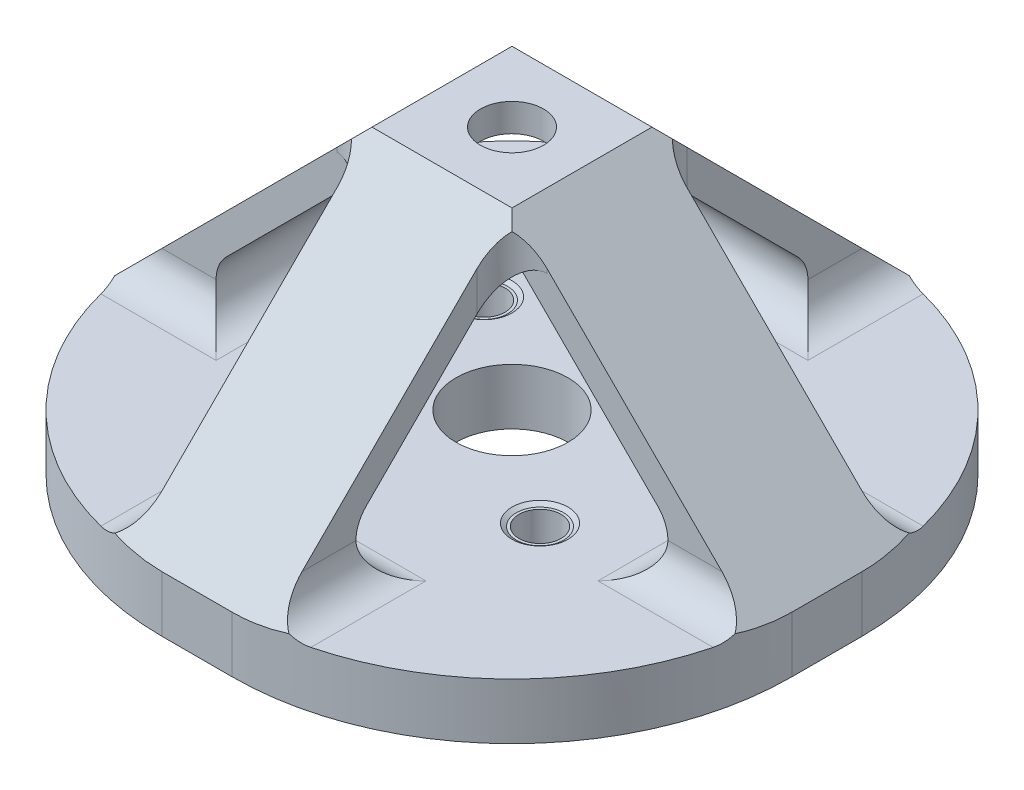
from build123d import *
from OCP.BRepFilletAPI import BRepFilletAPI_MakeChamfer

# Parameters (mm, degrees)
SKETCH1_W           = 45
SKETCH1_H           = 45
BOSS_EXTRUDE1_DEPTH = 4
SKETCH2_R           = 1.5
CUT_EXTRUDE1_DEPTH  = 4
SKETCH3_R           = 2
CUT_EXTRUDE2_DEPTH  = 0.2
CHAMFER1_SIZE       = 0.2
CHAMFER1_SIZE_2     = 0.307972993
BOSS_EXTRUDE2_DEPTH = 5
BOSS_EXTRUDE3_DEPTH = 5
SKETCH7_R           = 2.25
CUT_EXTRUDE3_DEPTH  = 32
SKETCH8_R           = 4
CUT_EXTRUDE4_DEPTH  = 10
FILLET1_R           = 2.5
FILLET2_R           = 20


# Some blends are built 0.0001 mm under size
with BuildPart() as part:
    # Sketch1 → Boss-Extrude1 (new body)
    with BuildSketch(Plane(origin=(0, 0, 0), x_dir=(1, 0, 0), z_dir=(0, 1, 0))):
        Rectangle(SKETCH1_W, SKETCH1_H)
    extrude(amount=BOSS_EXTRUDE1_DEPTH)

    # Sketch2 → Cut-Extrude1 (cut)
    with BuildSketch(Plane(origin=(0, 4, 0), x_dir=(1, 0, 0), z_dir=(0, 1, 0))):
        with Locations(Location((-8, 6, 0), (0, 0, 270))):
            Circle(SKETCH2_R)
        with Locations(Location((8, 6, 0), (0, 0, 270))):
            Circle(SKETCH2_R)
        with Locations(Location((8, -6, 0), (0, 0, 270))):
            Circle(SKETCH2_R)
        with Locations(Location((-8, -6, 0), (0, 0, 270))):
            Circle(SKETCH2_R)
    extrude(amount=-CUT_EXTRUDE1_DEPTH, mode=Mode.SUBTRACT)

    # Sketch3 → Cut-Extrude2 (cut)
    with BuildSketch(Plane(origin=(0, 4, 0), x_dir=(1, 0, 0), z_dir=(0, 1, 0))):
        with Locations(Location((-8, 6, 0), (0, 0, 270))):
            Circle(SKETCH3_R)
        with Locations(Location((8, 6, 0), (0, 0, 270))):
            Circle(SKETCH3_R)
        with Locations(Location((8, -6, 0), (0, 0, 270))):
            Circle(SKETCH3_R)
        with Locations(Location((-8, -6, 0), (0, 0, 270))):
            Circle(SKETCH3_R)
    extrude(amount=-CUT_EXTRUDE2_DEPTH, mode=Mode.SUBTRACT)

    # Chamfer1
    chamfer1_edges_1 = [part.edges().sort_by_distance(p)[0] for p in [
        (-8, 3.8, 4),
    ]]
    chamfer1_side_1 = [part.faces().sort_by_distance(p)[0] for p in [
        (-8, 3.804, 4),
    ]]
    chamfer1_edges_2 = [part.edges().sort_by_distance(p)[0] for p in [
        (8, 3.8, 4),
    ]]
    chamfer1_side_2 = [part.faces().sort_by_distance(p)[0] for p in [
        (8, 3.804, 4),
    ]]
    chamfer1_edges_3 = [part.edges().sort_by_distance(p)[0] for p in [
        (8, 3.8, -8),
    ]]
    chamfer1_side_3 = [part.faces().sort_by_distance(p)[0] for p in [
        (8, 3.804, -8),
    ]]
    chamfer1_edges_4 = [part.edges().sort_by_distance(p)[0] for p in [
        (-8, 3.8, -8),
    ]]
    chamfer1_side_4 = [part.faces().sort_by_distance(p)[0] for p in [
        (-8, 3.804, -8),
    ]]
    chamfer1 = BRepFilletAPI_MakeChamfer(part.part.solid().wrapped)
    for e in chamfer1_edges_1:
        chamfer1.Add(CHAMFER1_SIZE - 0.0001, CHAMFER1_SIZE_2 - 0.0001, e.wrapped, chamfer1_side_1[0].wrapped)
    for e in chamfer1_edges_2:
        chamfer1.Add(CHAMFER1_SIZE - 0.0001, CHAMFER1_SIZE_2 - 0.0001, e.wrapped, chamfer1_side_2[0].wrapped)
    for e in chamfer1_edges_3:
        chamfer1.Add(CHAMFER1_SIZE - 0.0001, CHAMFER1_SIZE_2 - 0.0001, e.wrapped, chamfer1_side_3[0].wrapped)
    for e in chamfer1_edges_4:
        chamfer1.Add(CHAMFER1_SIZE - 0.0001, CHAMFER1_SIZE_2 - 0.0001, e.wrapped, chamfer1_side_4[0].wrapped)
    add(Compound.cast(chamfer1.Shape()), mode=Mode.REPLACE)  # a hair under: the kernel refuses the full size

    # Sketch5 → Boss-Extrude2 (add, symmetric)
    with BuildSketch(Plane.XY):
        Polygon((-5, 21.5), (-22.5, 4), (-21.085786438, 2.585786438), (-4.171572875, 19.5), (4.171572875, 19.5), (21.085786438, 2.585786438), (22.5, 4), (5, 21.5), align=None)
    extrude(amount=BOSS_EXTRUDE2_DEPTH, both=True)

    # Sketch6 → Boss-Extrude3 (add, symmetric)
    with BuildSketch(Plane(origin=(0, 0, 0), x_dir=(0, 0, -1), z_dir=(1, 0, 0))):
        Polygon((-5, 21.5), (-22.5, 4), (-21.084645553, 2.586928244), (-4.198851287, 19.5), (-2.202076898, 21.5), align=None)
        Polygon((22.5, 4), (5, 21.5), (2.171572875, 21.5), (4.171572875, 19.5), (21.085786438, 2.585786438), align=None)
    extrude(amount=BOSS_EXTRUDE3_DEPTH, both=True)

    # Sketch7 → Cut-Extrude3 (cut)
    with BuildSketch(Plane(origin=(0, 21.5, 0), x_dir=(1, 0, 0), z_dir=(0, 1, 0))):
        with Locations(Location((0, 0, 0), (0, 0, 270))):
            Circle(SKETCH7_R)
    extrude(amount=-CUT_EXTRUDE3_DEPTH, mode=Mode.SUBTRACT)

    # Sketch8 → Cut-Extrude4 (cut)
    with BuildSketch(Plane.XZ):
        with Locations(Location((0, 0, 0), (0, 0, 270))):
            Circle(SKETCH8_R)
    extrude(amount=-CUT_EXTRUDE4_DEPTH, mode=Mode.SUBTRACT)

    # Fillet1
    # the kernel refuses this fillet: 2.5 mm, written as the material it adds along each edge
    with BuildSketch(Plane(origin=(-5, 12.447557103, 5), x_dir=(0, 0, 1), z_dir=(0, 1, 0))) as fillet1_piece_1_section:
        with BuildLine():
            CenterArc((FILLET1_R, -FILLET1_R), FILLET1_R, 90, 90)
            Line((0, -FILLET1_R), (0, 0))
            Line((0, 0), (FILLET1_R, 0))
        make_face()
    fillet1_piece_1 = extrude(amount=15.302442897, mode=Mode.PRIVATE)
    fillet1_piece_1 = split(fillet1_piece_1, bisect_by=Plane(origin=(-5, 15.567513023, 8.124995929), z_dir=(0, 0.7065358781304153, 0.707677223679329)), keep=Keep.TOP, mode=Mode.PRIVATE)
    fillet1_piece_1 = split(fillet1_piece_1, bisect_by=Plane(origin=(-5, 16.973778552, 9.526221448), z_dir=(0, -0.7071067811865495, -0.7071067811865457)), keep=Keep.TOP, mode=Mode.PRIVATE)
    fillet1_piece_1 = split(fillet1_piece_1, bisect_by=Plane(origin=(-9.526221448, 16.973778552, 5), z_dir=(0.7071067811865489, -0.7071067811865462, 0)), keep=Keep.TOP, mode=Mode.PRIVATE)
    add(fillet1_piece_1)
    with BuildSketch(Plane(origin=(5, 12.447557103, 5), x_dir=(1, 0, 0), z_dir=(0, 1, 0))) as fillet1_piece_2_section:
        with BuildLine():
            CenterArc((FILLET1_R, -FILLET1_R), FILLET1_R, 90, 90)
            Line((0, -FILLET1_R), (0, 0))
            Line((0, 0), (FILLET1_R, 0))
        make_face()
    fillet1_piece_2 = extrude(amount=15.302442897, mode=Mode.PRIVATE)
    fillet1_piece_2 = split(fillet1_piece_2, bisect_by=Plane(origin=(5, 15.567513023, 8.124995929), z_dir=(0, 0.7065358781304153, 0.707677223679329)), keep=Keep.TOP, mode=Mode.PRIVATE)
    fillet1_piece_2 = split(fillet1_piece_2, bisect_by=Plane(origin=(9.526221448, 16.973778552, 5), z_dir=(-0.7071067811865437, -0.7071067811865513, 0)), keep=Keep.TOP, mode=Mode.PRIVATE)
    fillet1_piece_2 = split(fillet1_piece_2, bisect_by=Plane(origin=(5, 16.973778552, 9.526221448), z_dir=(0, -0.7071067811865495, -0.7071067811865457)), keep=Keep.TOP, mode=Mode.PRIVATE)
    add(fillet1_piece_2)
    with BuildSketch(Plane(origin=(4.171572875, 19.5, -6.76040764), x_dir=(0.7071067811865543, -0.7071067811865406, 0), z_dir=(0, 0, 1))) as fillet1_piece_3:
        with BuildLine():
            CenterArc((FILLET1_R * 0.414213562373, -FILLET1_R), FILLET1_R, 90, 45)
            Line((-FILLET1_R * 0.292893218813, -FILLET1_R * 0.292893218813), (0, 0))
            Line((0, 0), (FILLET1_R * 0.414213562373, 0))
        make_face()
    extrude(amount=13.548093692)
    with BuildSketch(Plane(origin=(-4.171572875, 19.5, -6.76040764), x_dir=(-0.7071067811865471, -0.707106781186548, 0), z_dir=(0, 0, 1))) as fillet1_piece_4:
        with BuildLine():
            CenterArc((FILLET1_R * 0.414213562373, FILLET1_R), FILLET1_R, 225, 45)
            Line((-FILLET1_R * 0.292893218813, FILLET1_R * 0.292893218813), (0, 0))
            Line((0, 0), (FILLET1_R * 0.414213562373, 0))
        make_face()
    extrude(amount=13.548093692)
    with BuildSketch(Plane(origin=(-5, 4, 19.673852806), x_dir=(0, 0, -1), z_dir=(1, 0, 0))) as fillet1_piece_5:
        with BuildLine():
            CenterArc((FILLET1_R * 2.41146079177, FILLET1_R), FILLET1_R, 135.046240746, 134.953759254)
            Line((FILLET1_R * 1.70378356809, FILLET1_R * 1.70653587813), (0, 0))
            Line((0, 0), (FILLET1_R * 2.41146079177, 0))
        make_face()
    extrude(amount=10)
    with BuildSketch(Plane(origin=(-5, 4, 13.423852806), x_dir=(-1, 0, 0), z_dir=(0, 0, 1))) as fillet1_piece_6_section:
        with BuildLine():
            CenterArc((FILLET1_R, -FILLET1_R), FILLET1_R, 90, 90)
            Line((0, -FILLET1_R), (0, 0))
            Line((0, 0), (FILLET1_R, 0))
        make_face()
    fillet1_piece_6 = extrude(amount=15.326147194, mode=Mode.PRIVATE)
    fillet1_piece_6 = split(fillet1_piece_6, bisect_by=Plane(origin=(-5, 7.124995929, 16.553896887), z_dir=(0, 0.7065358781304153, 0.707677223679329)), keep=Keep.TOP, mode=Mode.PRIVATE)
    fillet1_piece_6 = split(fillet1_piece_6, bisect_by=Plane(origin=(-5, 8.538073597, 17.961926403), z_dir=(0, -0.7071067811865495, -0.7071067811865457)), keep=Keep.TOP, mode=Mode.PRIVATE)
    add(fillet1_piece_6)
    with BuildSketch(Plane(origin=(-6.76336289, 19.5, 4.198851287), x_dir=(0, -0.7076772236793294, 0.706535878130415), z_dir=(1, 0, 0))) as fillet1_piece_7:
        with BuildLine():
            CenterArc((FILLET1_R * 0.414686402289, FILLET1_R), FILLET1_R, 224.953759254, 45.046240746)
            Line((-FILLET1_R * 0.29299082139, FILLET1_R * 0.29346412187), (0, 0))
            Line((0, 0), (FILLET1_R * 0.414686402289, 0))
        make_face()
    extrude(amount=13.526725779)
    with BuildSketch(Plane(origin=(5, 4, 13.423852806), x_dir=(1, 0, 0), z_dir=(0, 0, 1))) as fillet1_piece_8_section:
        with BuildLine():
            CenterArc((FILLET1_R, FILLET1_R), FILLET1_R, 180, 90)
            Line((0, FILLET1_R), (0, 0))
            Line((0, 0), (FILLET1_R, 0))
        make_face()
    fillet1_piece_8 = extrude(amount=15.326147194, mode=Mode.PRIVATE)
    fillet1_piece_8 = split(fillet1_piece_8, bisect_by=Plane(origin=(5, 7.124995929, 16.553896887), z_dir=(0, 0.7065358781304153, 0.707677223679329)), keep=Keep.TOP, mode=Mode.PRIVATE)
    fillet1_piece_8 = split(fillet1_piece_8, bisect_by=Plane(origin=(5, 8.538073597, 17.961926403), z_dir=(0, -0.7071067811865495, -0.7071067811865457)), keep=Keep.TOP, mode=Mode.PRIVATE)
    add(fillet1_piece_8)
    with BuildSketch(Plane(origin=(-5, 12.421572875, -5), x_dir=(0, 0, -1), z_dir=(0, 1, 0))) as fillet1_piece_9_section:
        with BuildLine():
            CenterArc((FILLET1_R, FILLET1_R), FILLET1_R, 180, 90)
            Line((0, FILLET1_R), (0, 0))
            Line((0, 0), (FILLET1_R, 0))
        make_face()
    fillet1_piece_9 = extrude(amount=15.328427125, mode=Mode.PRIVATE)
    fillet1_piece_9 = split(fillet1_piece_9, bisect_by=Plane(origin=(-8.125, 15.546572875, -5), z_dir=(-0.7071067811865477, 0.7071067811865475, 0)), keep=Keep.TOP, mode=Mode.PRIVATE)
    fillet1_piece_9 = split(fillet1_piece_9, bisect_by=Plane(origin=(-5, 16.960786438, -9.539213562), z_dir=(0, -0.7071067811865464, 0.7071067811865488)), keep=Keep.TOP, mode=Mode.PRIVATE)
    fillet1_piece_9 = split(fillet1_piece_9, bisect_by=Plane(origin=(-9.539213562, 16.960786438, -5), z_dir=(0.7071067811865489, -0.7071067811865462, 0)), keep=Keep.TOP, mode=Mode.PRIVATE)
    add(fillet1_piece_9)
    with BuildSketch(Plane(origin=(-5, 12.421572875, -5), x_dir=(0, 0, -1), z_dir=(0, 1, 0))) as fillet1_piece_10_section:
        with BuildLine():
            CenterArc((FILLET1_R, FILLET1_R), FILLET1_R, 180, 90)
            Line((0, FILLET1_R), (0, 0))
            Line((0, 0), (FILLET1_R, 0))
        make_face()
    fillet1_piece_10 = extrude(amount=15.328427125, mode=Mode.PRIVATE)
    fillet1_piece_10 = split(fillet1_piece_10, bisect_by=Plane(origin=(-5, 15.546572875, -8.125), z_dir=(0, 0.7071067811865475, -0.7071067811865476)), keep=Keep.TOP, mode=Mode.PRIVATE)
    fillet1_piece_10 = split(fillet1_piece_10, bisect_by=Plane(origin=(-5, 16.960786438, -9.539213562), z_dir=(0, -0.7071067811865464, 0.7071067811865488)), keep=Keep.TOP, mode=Mode.PRIVATE)
    fillet1_piece_10 = split(fillet1_piece_10, bisect_by=Plane(origin=(-9.539213562, 16.960786438, -5), z_dir=(0.7071067811865489, -0.7071067811865462, 0)), keep=Keep.TOP, mode=Mode.PRIVATE)
    add(fillet1_piece_10)
    with BuildSketch(Plane(origin=(5, 12.421572875, -5), x_dir=(1, 0, 0), z_dir=(0, 1, 0))) as fillet1_piece_11_section:
        with BuildLine():
            CenterArc((FILLET1_R, FILLET1_R), FILLET1_R, 180, 90)
            Line((0, FILLET1_R), (0, 0))
            Line((0, 0), (FILLET1_R, 0))
        make_face()
    fillet1_piece_11 = extrude(amount=15.328427125, mode=Mode.PRIVATE)
    fillet1_piece_11 = split(fillet1_piece_11, bisect_by=Plane(origin=(5, 15.546572875, -8.125), z_dir=(0, 0.7071067811865475, -0.7071067811865476)), keep=Keep.TOP, mode=Mode.PRIVATE)
    fillet1_piece_11 = split(fillet1_piece_11, bisect_by=Plane(origin=(9.539213562, 16.960786438, -5), z_dir=(-0.7071067811865437, -0.7071067811865513, 0)), keep=Keep.TOP, mode=Mode.PRIVATE)
    fillet1_piece_11 = split(fillet1_piece_11, bisect_by=Plane(origin=(5, 16.960786438, -9.539213562), z_dir=(0, -0.7071067811865464, 0.7071067811865488)), keep=Keep.TOP, mode=Mode.PRIVATE)
    add(fillet1_piece_11)
    with BuildSketch(Plane(origin=(5, 12.421572875, -5), x_dir=(1, 0, 0), z_dir=(0, 1, 0))) as fillet1_piece_12_section:
        with BuildLine():
            CenterArc((FILLET1_R, FILLET1_R), FILLET1_R, 180, 90)
            Line((0, FILLET1_R), (0, 0))
            Line((0, 0), (FILLET1_R, 0))
        make_face()
    fillet1_piece_12 = extrude(amount=15.328427125, mode=Mode.PRIVATE)
    fillet1_piece_12 = split(fillet1_piece_12, bisect_by=Plane(origin=(8.125, 15.546572875, -5), z_dir=(0.7071067811865437, 0.7071067811865513, 0)), keep=Keep.TOP, mode=Mode.PRIVATE)
    fillet1_piece_12 = split(fillet1_piece_12, bisect_by=Plane(origin=(9.539213562, 16.960786438, -5), z_dir=(-0.7071067811865437, -0.7071067811865513, 0)), keep=Keep.TOP, mode=Mode.PRIVATE)
    fillet1_piece_12 = split(fillet1_piece_12, bisect_by=Plane(origin=(5, 16.960786438, -9.539213562), z_dir=(0, -0.7071067811865464, 0.7071067811865488)), keep=Keep.TOP, mode=Mode.PRIVATE)
    add(fillet1_piece_12)
    with BuildSketch(Plane(origin=(6.76040764, 19.5, -4.171572875), x_dir=(0, -0.7071067811865476, -0.7071067811865476), z_dir=(-1, 0, 0))) as fillet1_piece_13:
        with BuildLine():
            CenterArc((FILLET1_R * 0.414213562373, FILLET1_R), FILLET1_R, 225, 45)
            Line((-FILLET1_R * 0.292893218813, FILLET1_R * 0.292893218813), (0, 0))
            Line((0, 0), (FILLET1_R * 0.414213562373, 0))
        make_face()
    extrude(amount=13.52081528)
    with BuildSketch(Plane(origin=(5, 4, -19.671572875), x_dir=(0, 0, 1), z_dir=(-1, 0, 0)), Plane(origin=(19.671572875, 4, 5), x_dir=(-1, 0, 0), z_dir=(0, 0, -1)), Plane(origin=(-19.671572875, 4, -5), x_dir=(1, 0, 0), z_dir=(0, 0, 1))) as fillet1_piece_14:
        with BuildLine():
            CenterArc((FILLET1_R * 2.41421356237, FILLET1_R), FILLET1_R, 135, 135)
            Line((FILLET1_R * 1.70710678119, FILLET1_R * 1.70710678119), (0, 0))
            Line((0, 0), (FILLET1_R * 2.41421356237, 0))
        make_face()
    extrude(amount=10)
    with BuildSketch(Plane(origin=(5, 4, -28.75), x_dir=(1, 0, 0), z_dir=(0, 0, 1))) as fillet1_piece_15_section:
        with BuildLine():
            CenterArc((FILLET1_R, FILLET1_R), FILLET1_R, 180, 90)
            Line((0, FILLET1_R), (0, 0))
            Line((0, 0), (FILLET1_R, 0))
        make_face()
    fillet1_piece_15 = extrude(amount=15.328427125, mode=Mode.PRIVATE)
    fillet1_piece_15 = split(fillet1_piece_15, bisect_by=Plane(origin=(5, -0.539213562, -24.210786438), z_dir=(0, 0.7071067811865475, -0.7071067811865476)), keep=Keep.TOP, mode=Mode.PRIVATE)
    fillet1_piece_15 = split(fillet1_piece_15, bisect_by=Plane(origin=(5, 0.875, -25.625), z_dir=(0, -0.7071067811865464, 0.7071067811865488)), keep=Keep.TOP, mode=Mode.PRIVATE)
    add(fillet1_piece_15)
    with BuildSketch(Plane(origin=(-5, 4, -28.75), x_dir=(-1, 0, 0), z_dir=(0, 0, 1))) as fillet1_piece_16_section:
        with BuildLine():
            CenterArc((FILLET1_R, -FILLET1_R), FILLET1_R, 90, 90)
            Line((0, -FILLET1_R), (0, 0))
            Line((0, 0), (FILLET1_R, 0))
        make_face()
    fillet1_piece_16 = extrude(amount=15.328427125, mode=Mode.PRIVATE)
    fillet1_piece_16 = split(fillet1_piece_16, bisect_by=Plane(origin=(-5, -0.539213562, -24.210786438), z_dir=(0, 0.7071067811865475, -0.7071067811865476)), keep=Keep.TOP, mode=Mode.PRIVATE)
    fillet1_piece_16 = split(fillet1_piece_16, bisect_by=Plane(origin=(-5, 0.875, -25.625), z_dir=(0, -0.7071067811865464, 0.7071067811865488)), keep=Keep.TOP, mode=Mode.PRIVATE)
    add(fillet1_piece_16)
    with BuildSketch(Plane(origin=(28.75, 4, -5), x_dir=(0, 0, -1), z_dir=(-1, 0, 0))) as fillet1_piece_17_section:
        with BuildLine():
            CenterArc((FILLET1_R, -FILLET1_R), FILLET1_R, 90, 90)
            Line((0, -FILLET1_R), (0, 0))
            Line((0, 0), (FILLET1_R, 0))
        make_face()
    fillet1_piece_17 = extrude(amount=15.328427125, mode=Mode.PRIVATE)
    fillet1_piece_17 = split(fillet1_piece_17, bisect_by=Plane(origin=(24.210786438, -0.539213562, -5), z_dir=(0.7071067811865437, 0.7071067811865513, 0)), keep=Keep.TOP, mode=Mode.PRIVATE)
    fillet1_piece_17 = split(fillet1_piece_17, bisect_by=Plane(origin=(25.625, 0.875, -5), z_dir=(-0.7071067811865437, -0.7071067811865513, 0)), keep=Keep.TOP, mode=Mode.PRIVATE)
    add(fillet1_piece_17)
    with BuildSketch(Plane(origin=(28.75, 4, 5), x_dir=(0, 0, 1), z_dir=(-1, 0, 0))) as fillet1_piece_18_section:
        with BuildLine():
            CenterArc((FILLET1_R, FILLET1_R), FILLET1_R, 180, 90)
            Line((0, FILLET1_R), (0, 0))
            Line((0, 0), (FILLET1_R, 0))
        make_face()
    fillet1_piece_18 = extrude(amount=15.328427125, mode=Mode.PRIVATE)
    fillet1_piece_18 = split(fillet1_piece_18, bisect_by=Plane(origin=(24.210786438, -0.539213562, 5), z_dir=(0.7071067811865437, 0.7071067811865513, 0)), keep=Keep.TOP, mode=Mode.PRIVATE)
    fillet1_piece_18 = split(fillet1_piece_18, bisect_by=Plane(origin=(25.625, 0.875, 5), z_dir=(-0.7071067811865437, -0.7071067811865513, 0)), keep=Keep.TOP, mode=Mode.PRIVATE)
    add(fillet1_piece_18)
    with BuildSketch(Plane(origin=(-13.421572875, 4, -5), x_dir=(0, 0, -1), z_dir=(-1, 0, 0))) as fillet1_piece_19_section:
        with BuildLine():
            CenterArc((FILLET1_R, -FILLET1_R), FILLET1_R, 90, 90)
            Line((0, -FILLET1_R), (0, 0))
            Line((0, 0), (FILLET1_R, 0))
        make_face()
    fillet1_piece_19 = extrude(amount=15.328427125, mode=Mode.PRIVATE)
    fillet1_piece_19 = split(fillet1_piece_19, bisect_by=Plane(origin=(-16.546572875, 7.125, -5), z_dir=(-0.7071067811865477, 0.7071067811865475, 0)), keep=Keep.TOP, mode=Mode.PRIVATE)
    fillet1_piece_19 = split(fillet1_piece_19, bisect_by=Plane(origin=(-17.960786438, 8.539213562, -5), z_dir=(0.7071067811865489, -0.7071067811865462, 0)), keep=Keep.TOP, mode=Mode.PRIVATE)
    add(fillet1_piece_19)
    with BuildSketch(Plane(origin=(-13.421572875, 4, 5), x_dir=(0, 0, 1), z_dir=(-1, 0, 0))) as fillet1_piece_20_section:
        with BuildLine():
            CenterArc((FILLET1_R, FILLET1_R), FILLET1_R, 180, 90)
            Line((0, FILLET1_R), (0, 0))
            Line((0, 0), (FILLET1_R, 0))
        make_face()
    fillet1_piece_20 = extrude(amount=15.328427125, mode=Mode.PRIVATE)
    fillet1_piece_20 = split(fillet1_piece_20, bisect_by=Plane(origin=(-16.546572875, 7.125, 5), z_dir=(-0.7071067811865477, 0.7071067811865475, 0)), keep=Keep.TOP, mode=Mode.PRIVATE)
    fillet1_piece_20 = split(fillet1_piece_20, bisect_by=Plane(origin=(-17.960786438, 8.539213562, 5), z_dir=(0.7071067811865489, -0.7071067811865462, 0)), keep=Keep.TOP, mode=Mode.PRIVATE)
    add(fillet1_piece_20)
    with BuildSketch(Plane(origin=(-20.071629949, 4, 19.673852806), x_dir=(0, 0, -1), z_dir=(1, 0, 0))) as fillet1_piece_21a_section:
        with BuildLine():
            CenterArc((FILLET1_R * 2.41146079177, FILLET1_R), FILLET1_R, 135.046240746, 134.953759254)
            Line((FILLET1_R * 1.70378356809, FILLET1_R * 1.70653587813), (0, 0))
            Line((0, 0), (FILLET1_R * 2.41146079177, 0))
        make_face()
    fillet1_piece_21a = extrude(amount=25.071629949, mode=Mode.PRIVATE)
    fillet1_piece_21a = split(fillet1_piece_21a, bisect_by=Plane(origin=(-5, 4, 19.673852806), z_dir=(-1, 0, 0)), keep=Keep.TOP, mode=Mode.PRIVATE)
    with BuildSketch(Plane(origin=(-5, 4, 13.423852806), x_dir=(-1, 0, 0), z_dir=(0, 0, 1))) as fillet1_piece_21b_section:
        with BuildLine():
            CenterArc((FILLET1_R, -FILLET1_R), FILLET1_R, 90, 90)
            Line((0, -FILLET1_R), (0, 0))
            Line((0, 0), (FILLET1_R, 0))
        make_face()
    fillet1_piece_21b = extrude(amount=9.076147194, mode=Mode.PRIVATE)
    fillet1_piece_21b = split(fillet1_piece_21b, bisect_by=Plane(origin=(-5, 7.124995929, 16.553896887), z_dir=(0, -0.7065358781304153, -0.707677223679329)), keep=Keep.TOP, mode=Mode.PRIVATE)
    fillet1_piece_21 = fillet1_piece_21a & fillet1_piece_21b
    add(fillet1_piece_21)
    with BuildSketch(Plane(origin=(5, 4, 13.423852806), x_dir=(1, 0, 0), z_dir=(0, 0, 1))) as fillet1_piece_22a_section:
        with BuildLine():
            CenterArc((FILLET1_R, FILLET1_R), FILLET1_R, 180, 90)
            Line((0, FILLET1_R), (0, 0))
            Line((0, 0), (FILLET1_R, 0))
        make_face()
    fillet1_piece_22a = extrude(amount=9.076147194, mode=Mode.PRIVATE)
    fillet1_piece_22a = split(fillet1_piece_22a, bisect_by=Plane(origin=(5, 7.124995929, 16.553896887), z_dir=(0, -0.7065358781304153, -0.707677223679329)), keep=Keep.TOP, mode=Mode.PRIVATE)
    with BuildSketch(Plane(origin=(-5, 4, 19.673852806), x_dir=(0, 0, -1), z_dir=(1, 0, 0))) as fillet1_piece_22b_section:
        with BuildLine():
            CenterArc((FILLET1_R * 2.41146079177, FILLET1_R), FILLET1_R, 135.046240746, 134.953759254)
            Line((FILLET1_R * 1.70378356809, FILLET1_R * 1.70653587813), (0, 0))
            Line((0, 0), (FILLET1_R * 2.41146079177, 0))
        make_face()
    fillet1_piece_22b = extrude(amount=25.071629949, mode=Mode.PRIVATE)
    fillet1_piece_22b = split(fillet1_piece_22b, bisect_by=Plane(origin=(5, 4, 19.673852806), z_dir=(1, 0, 0)), keep=Keep.TOP, mode=Mode.PRIVATE)
    fillet1_piece_22 = fillet1_piece_22a & fillet1_piece_22b
    add(fillet1_piece_22)
    with BuildSketch(Plane(origin=(5, 4, -22.5), x_dir=(1, 0, 0), z_dir=(0, 0, 1))) as fillet1_piece_23a_section:
        with BuildLine():
            CenterArc((FILLET1_R, FILLET1_R), FILLET1_R, 180, 90)
            Line((0, FILLET1_R), (0, 0))
            Line((0, 0), (FILLET1_R, 0))
        make_face()
    fillet1_piece_23a = extrude(amount=9.078427125, mode=Mode.PRIVATE)
    fillet1_piece_23a = split(fillet1_piece_23a, bisect_by=Plane(origin=(5, 2.585786438, -21.085786438), z_dir=(0, -0.7071067811865475, 0.7071067811865476)), keep=Keep.TOP, mode=Mode.PRIVATE)
    with BuildSketch(Plane(origin=(20.088834765, 4, -19.671572875), x_dir=(0, 0, 1), z_dir=(-1, 0, 0))) as fillet1_piece_23b_section:
        with BuildLine():
            CenterArc((FILLET1_R * 2.41421356237, FILLET1_R), FILLET1_R, 135, 135)
            Line((FILLET1_R * 1.70710678119, FILLET1_R * 1.70710678119), (0, 0))
            Line((0, 0), (FILLET1_R * 2.41421356237, 0))
        make_face()
    fillet1_piece_23b = extrude(amount=25.088834765, mode=Mode.PRIVATE)
    fillet1_piece_23b = split(fillet1_piece_23b, bisect_by=Plane(origin=(5, 4, -19.671572875), z_dir=(1, 0, 0)), keep=Keep.TOP, mode=Mode.PRIVATE)
    fillet1_piece_23 = fillet1_piece_23a & fillet1_piece_23b
    add(fillet1_piece_23)
    with BuildSketch(Plane(origin=(5, 4, -19.671572875), x_dir=(0, 0, 1), z_dir=(-1, 0, 0))) as fillet1_piece_24a_section:
        with BuildLine():
            CenterArc((FILLET1_R * 2.41421356237, FILLET1_R), FILLET1_R, 135, 135)
            Line((FILLET1_R * 1.70710678119, FILLET1_R * 1.70710678119), (0, 0))
            Line((0, 0), (FILLET1_R * 2.41421356237, 0))
        make_face()
    fillet1_piece_24a = extrude(amount=25.088834765, mode=Mode.PRIVATE)
    fillet1_piece_24a = split(fillet1_piece_24a, bisect_by=Plane(origin=(-5, 4, -19.671572875), z_dir=(-1, 0, 0)), keep=Keep.TOP, mode=Mode.PRIVATE)
    with BuildSketch(Plane(origin=(-5, 4, -22.5), x_dir=(-1, 0, 0), z_dir=(0, 0, 1))) as fillet1_piece_24b_section:
        with BuildLine():
            CenterArc((FILLET1_R, -FILLET1_R), FILLET1_R, 90, 90)
            Line((0, -FILLET1_R), (0, 0))
            Line((0, 0), (FILLET1_R, 0))
        make_face()
    fillet1_piece_24b = extrude(amount=9.078427125, mode=Mode.PRIVATE)
    fillet1_piece_24b = split(fillet1_piece_24b, bisect_by=Plane(origin=(-5, 2.585786438, -21.085786438), z_dir=(0, -0.7071067811865475, 0.7071067811865476)), keep=Keep.TOP, mode=Mode.PRIVATE)
    fillet1_piece_24 = fillet1_piece_24a & fillet1_piece_24b
    add(fillet1_piece_24)
    with BuildSketch(Plane(origin=(19.671572875, 4, 5), x_dir=(-1, 0, 0), z_dir=(0, 0, -1))) as fillet1_piece_25a_section:
        with BuildLine():
            CenterArc((FILLET1_R * 2.41421356237, FILLET1_R), FILLET1_R, 135, 135)
            Line((FILLET1_R * 1.70710678119, FILLET1_R * 1.70710678119), (0, 0))
            Line((0, 0), (FILLET1_R * 2.41421356237, 0))
        make_face()
    fillet1_piece_25a = extrude(amount=25.088834765, mode=Mode.PRIVATE)
    fillet1_piece_25a = split(fillet1_piece_25a, bisect_by=Plane(origin=(19.671572875, 4, -5), z_dir=(0, 0, -1)), keep=Keep.TOP, mode=Mode.PRIVATE)
    with BuildSketch(Plane(origin=(22.5, 4, -5), x_dir=(0, 0, -1), z_dir=(-1, 0, 0))) as fillet1_piece_25b_section:
        with BuildLine():
            CenterArc((FILLET1_R, -FILLET1_R), FILLET1_R, 90, 90)
            Line((0, -FILLET1_R), (0, 0))
            Line((0, 0), (FILLET1_R, 0))
        make_face()
    fillet1_piece_25b = extrude(amount=9.078427125, mode=Mode.PRIVATE)
    fillet1_piece_25b = split(fillet1_piece_25b, bisect_by=Plane(origin=(21.085786438, 2.585786438, -5), z_dir=(-0.7071067811865437, -0.7071067811865513, 0)), keep=Keep.TOP, mode=Mode.PRIVATE)
    fillet1_piece_25 = fillet1_piece_25a & fillet1_piece_25b
    add(fillet1_piece_25)
    with BuildSketch(Plane(origin=(22.5, 4, 5), x_dir=(0, 0, 1), z_dir=(-1, 0, 0))) as fillet1_piece_26a_section:
        with BuildLine():
            CenterArc((FILLET1_R, FILLET1_R), FILLET1_R, 180, 90)
            Line((0, FILLET1_R), (0, 0))
            Line((0, 0), (FILLET1_R, 0))
        make_face()
    fillet1_piece_26a = extrude(amount=9.078427125, mode=Mode.PRIVATE)
    fillet1_piece_26a = split(fillet1_piece_26a, bisect_by=Plane(origin=(21.085786438, 2.585786438, 5), z_dir=(-0.7071067811865437, -0.7071067811865513, 0)), keep=Keep.TOP, mode=Mode.PRIVATE)
    with BuildSketch(Plane(origin=(19.671572875, 4, 20.088834765), x_dir=(-1, 0, 0), z_dir=(0, 0, -1))) as fillet1_piece_26b_section:
        with BuildLine():
            CenterArc((FILLET1_R * 2.41421356237, FILLET1_R), FILLET1_R, 135, 135)
            Line((FILLET1_R * 1.70710678119, FILLET1_R * 1.70710678119), (0, 0))
            Line((0, 0), (FILLET1_R * 2.41421356237, 0))
        make_face()
    fillet1_piece_26b = extrude(amount=25.088834765, mode=Mode.PRIVATE)
    fillet1_piece_26b = split(fillet1_piece_26b, bisect_by=Plane(origin=(19.671572875, 4, 5), z_dir=(0, 0, 1)), keep=Keep.TOP, mode=Mode.PRIVATE)
    fillet1_piece_26 = fillet1_piece_26a & fillet1_piece_26b
    add(fillet1_piece_26)
    with BuildSketch(Plane(origin=(-19.671572875, 4, -20.088834765), x_dir=(1, 0, 0), z_dir=(0, 0, 1))) as fillet1_piece_27a_section:
        with BuildLine():
            CenterArc((FILLET1_R * 2.41421356237, FILLET1_R), FILLET1_R, 135, 135)
            Line((FILLET1_R * 1.70710678119, FILLET1_R * 1.70710678119), (0, 0))
            Line((0, 0), (FILLET1_R * 2.41421356237, 0))
        make_face()
    fillet1_piece_27a = extrude(amount=25.088834765, mode=Mode.PRIVATE)
    fillet1_piece_27a = split(fillet1_piece_27a, bisect_by=Plane(origin=(-19.671572875, 4, -5), z_dir=(0, 0, -1)), keep=Keep.TOP, mode=Mode.PRIVATE)
    with BuildSketch(Plane(origin=(-13.421572875, 4, -5), x_dir=(0, 0, -1), z_dir=(-1, 0, 0))) as fillet1_piece_27b_section:
        with BuildLine():
            CenterArc((FILLET1_R, -FILLET1_R), FILLET1_R, 90, 90)
            Line((0, -FILLET1_R), (0, 0))
            Line((0, 0), (FILLET1_R, 0))
        make_face()
    fillet1_piece_27b = extrude(amount=9.078427125, mode=Mode.PRIVATE)
    fillet1_piece_27b = split(fillet1_piece_27b, bisect_by=Plane(origin=(-16.546572875, 7.125, -5), z_dir=(0.7071067811865477, -0.7071067811865475, 0)), keep=Keep.TOP, mode=Mode.PRIVATE)
    fillet1_piece_27 = fillet1_piece_27a & fillet1_piece_27b
    add(fillet1_piece_27)
    with BuildSketch(Plane(origin=(-13.421572875, 4, 5), x_dir=(0, 0, 1), z_dir=(-1, 0, 0))) as fillet1_piece_28a_section:
        with BuildLine():
            CenterArc((FILLET1_R, FILLET1_R), FILLET1_R, 180, 90)
            Line((0, FILLET1_R), (0, 0))
            Line((0, 0), (FILLET1_R, 0))
        make_face()
    fillet1_piece_28a = extrude(amount=9.078427125, mode=Mode.PRIVATE)
    fillet1_piece_28a = split(fillet1_piece_28a, bisect_by=Plane(origin=(-16.546572875, 7.125, 5), z_dir=(0.7071067811865477, -0.7071067811865475, 0)), keep=Keep.TOP, mode=Mode.PRIVATE)
    with BuildSketch(Plane(origin=(-19.671572875, 4, -5), x_dir=(1, 0, 0), z_dir=(0, 0, 1))) as fillet1_piece_28b_section:
        with BuildLine():
            CenterArc((FILLET1_R * 2.41421356237, FILLET1_R), FILLET1_R, 135, 135)
            Line((FILLET1_R * 1.70710678119, FILLET1_R * 1.70710678119), (0, 0))
            Line((0, 0), (FILLET1_R * 2.41421356237, 0))
        make_face()
    fillet1_piece_28b = extrude(amount=25.088834765, mode=Mode.PRIVATE)
    fillet1_piece_28b = split(fillet1_piece_28b, bisect_by=Plane(origin=(-19.671572875, 4, 5), z_dir=(0, 0, 1)), keep=Keep.TOP, mode=Mode.PRIVATE)
    fillet1_piece_28 = fillet1_piece_28a & fillet1_piece_28b
    add(fillet1_piece_28)

    # Fillet2
    # the kernel refuses this fillet: 20 mm, written as the material it takes off along each edge
    with BuildSketch(Plane(origin=(22.5, -50, 22.5), x_dir=(0, 0, -1), z_dir=(0, 1, 0)), Plane(origin=(-22.5, -50, 22.5), x_dir=(1, 0, 0), z_dir=(0, 1, 0))) as fillet2_piece_1:
        with BuildLine():
            CenterArc((FILLET2_R, FILLET2_R), FILLET2_R, 180, 90)
            Line((0, FILLET2_R), (0, 0))
            Line((0, 0), (FILLET2_R, 0))
        make_face()
    extrude(amount=104, mode=Mode.SUBTRACT)
    with BuildSketch(Plane(origin=(22.5, -50, -22.5), x_dir=(0, 0, 1), z_dir=(0, 1, 0)), Plane(origin=(-22.5, -50, -22.5), x_dir=(1, 0, 0), z_dir=(0, 1, 0))) as fillet2_piece_2:
        with BuildLine():
            CenterArc((FILLET2_R, -FILLET2_R), FILLET2_R, 90, 90)
            Line((0, -FILLET2_R), (0, 0))
            Line((0, 0), (FILLET2_R, 0))
        make_face()
    extrude(amount=104, mode=Mode.SUBTRACT)


solid = part.part
